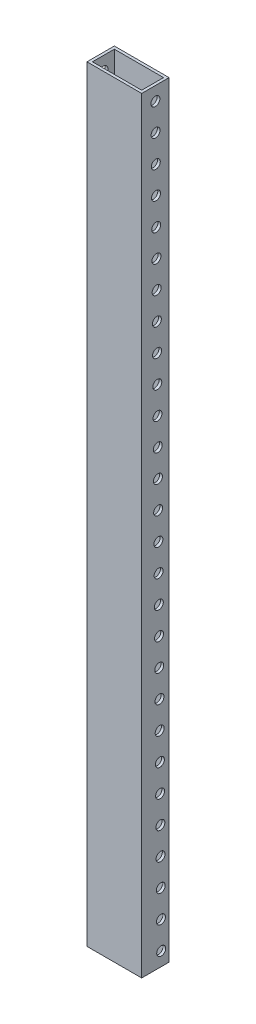
from build123d import *

# Parameters (mm, degrees)
BOSS_EXTRUDE1_OUTLINE_W   = 50.8
BOSS_EXTRUDE1_OUTLINE_H   = 25.4
BOSS_EXTRUDE1_OUTLINE_W_2 = 45.72
BOSS_EXTRUDE1_OUTLINE_H_2 = 20.32
BOSS_EXTRUDE1_DEPTH       = 711.2
SKETCH3_R                 = 4.166708964
CUT_EXTRUDE1_DEPTH        = 809.244


# Read off the part's stored shape, not the designer's step: Boss-Extrude1
with BuildPart() as part:
    # Boss-Extrude1 outline → Boss-Extrude1 (new body)
    with BuildSketch(Plane(origin=(0, 0, 0), x_dir=(1, 0, 0), z_dir=(0, 1, 0))):
        with Locations((-94.215820821, 5.423243243)):
            Rectangle(BOSS_EXTRUDE1_OUTLINE_W, BOSS_EXTRUDE1_OUTLINE_H)
        with Locations((-94.215820821, 5.423243243)):
            Rectangle(BOSS_EXTRUDE1_OUTLINE_W_2, BOSS_EXTRUDE1_OUTLINE_H_2, mode=Mode.SUBTRACT)
    extrude(amount=BOSS_EXTRUDE1_DEPTH)

    # Sketch3 → Cut-Extrude1 (cut)
    with BuildSketch(Plane(origin=(0, 0, 0), x_dir=(0, 0, -1), z_dir=(1, 0, 0))):
        with Locations(Location((5.423243243, 698.5, 0), (0, 0, 180))):
            Circle(SKETCH3_R)
        with Locations(Location((5.623719473, 673.100791168, 0), (0, 0, 180))):
            Circle(SKETCH3_R)
        with Locations(Location((5.824195703, 647.701582336, 0), (0, 0, 180))):
            Circle(SKETCH3_R)
        with Locations(Location((6.024671933, 622.302373505, 0), (0, 0, 180))):
            Circle(SKETCH3_R)
        with Locations(Location((6.225148163, 596.903164673, 0), (0, 0, 180))):
            Circle(SKETCH3_R)
        with Locations(Location((6.425624393, 571.503955841, 0), (0, 0, 180))):
            Circle(SKETCH3_R)
        with Locations(Location((6.626100623, 546.104747009, 0), (0, 0, 180))):
            Circle(SKETCH3_R)
        with Locations(Location((6.826576853, 520.705538177, 0), (0, 0, 180))):
            Circle(SKETCH3_R)
        with Locations(Location((7.027053082, 495.306329346, 0), (0, 0, 180))):
            Circle(SKETCH3_R)
        with Locations(Location((7.227529312, 469.907120514, 0), (0, 0, 180))):
            Circle(SKETCH3_R)
        with Locations(Location((7.428005542, 444.507911682, 0), (0, 0, 180))):
            Circle(SKETCH3_R)
        with Locations(Location((7.628481772, 419.10870285, 0), (0, 0, 180))):
            Circle(SKETCH3_R)
        with Locations(Location((7.828958002, 393.709494018, 0), (0, 0, 180))):
            Circle(SKETCH3_R)
        with Locations(Location((8.029434232, 368.310285187, 0), (0, 0, 180))):
            Circle(SKETCH3_R)
        with Locations(Location((8.229910462, 342.911076355, 0), (0, 0, 180))):
            Circle(SKETCH3_R)
        with Locations(Location((8.430386692, 317.511867523, 0), (0, 0, 180))):
            Circle(SKETCH3_R)
        with Locations(Location((8.630862922, 292.112658691, 0), (0, 0, 180))):
            Circle(SKETCH3_R)
        with Locations(Location((8.831339152, 266.713449859, 0), (0, 0, 180))):
            Circle(SKETCH3_R)
        with Locations(Location((9.031815381, 241.314241028, 0), (0, 0, 180))):
            Circle(SKETCH3_R)
        with Locations(Location((9.232291611, 215.915032196, 0), (0, 0, 180))):
            Circle(SKETCH3_R)
        with Locations(Location((9.432767841, 190.515823364, 0), (0, 0, 180))):
            Circle(SKETCH3_R)
        with Locations(Location((9.633244071, 165.116614532, 0), (0, 0, 180))):
            Circle(SKETCH3_R)
        with Locations(Location((9.833720301, 139.7174057, 0), (0, 0, 180))):
            Circle(SKETCH3_R)
        with Locations(Location((10.034196531, 114.318196869, 0), (0, 0, 180))):
            Circle(SKETCH3_R)
        with Locations(Location((10.234672761, 88.918988037, 0), (0, 0, 180))):
            Circle(SKETCH3_R)
        with Locations(Location((10.435148991, 63.519779205, 0), (0, 0, 180))):
            Circle(SKETCH3_R)
        with Locations(Location((10.635625221, 38.120570373, 0), (0, 0, 180))):
            Circle(SKETCH3_R)
        with Locations(Location((10.836101451, 12.721361541, 0), (0, 0, 180))):
            Circle(SKETCH3_R)
    extrude(amount=-CUT_EXTRUDE1_DEPTH, mode=Mode.SUBTRACT)


solid = part.part
